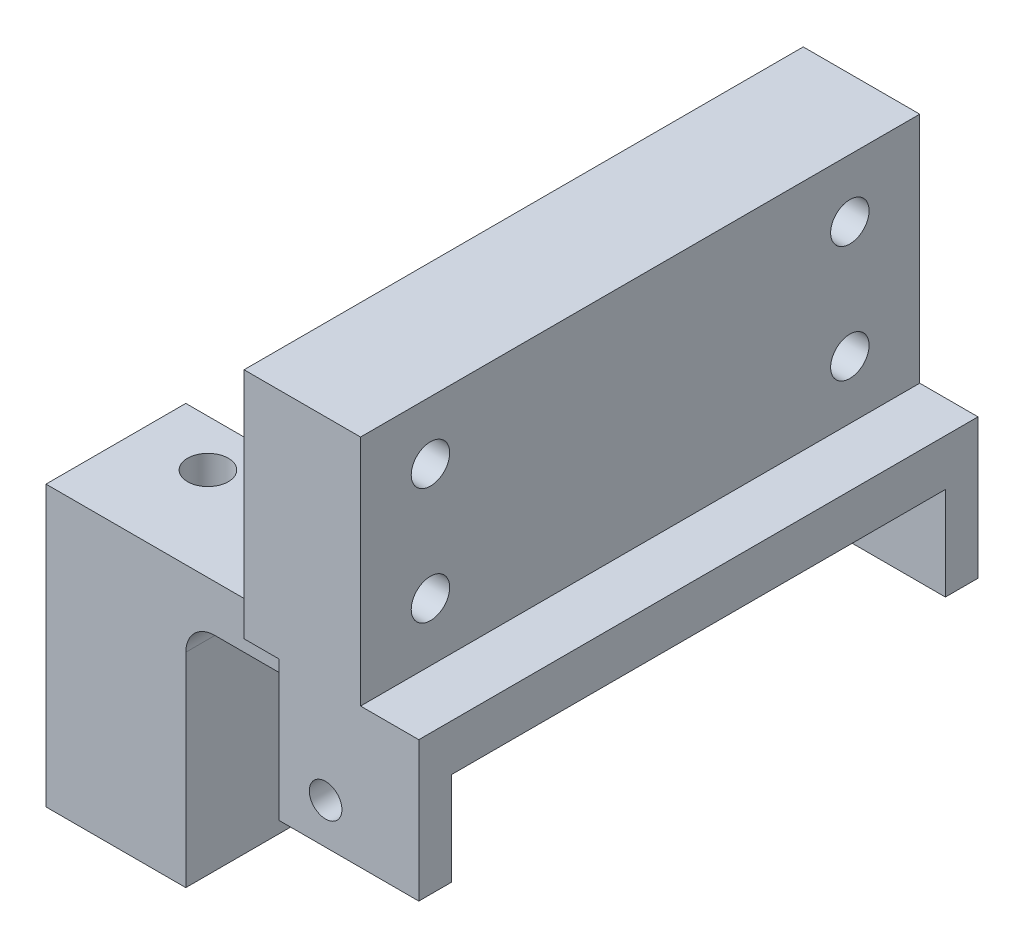
from build123d import *

# Parameters (mm, degrees)
SKETCH_1_W          = 20
SKETCH_1_H          = 48
EXTRUDE_2_DEPTH     = 4
SKETCH_3_W          = 20
SKETCH_3_H          = 3
EXTRUDE_3_DEPTH     = 8
SKETCH_4_W          = 12
SKETCH_4_H          = 4
EXTRUDE_4_DEPTH     = 15
SKETCH_5_R          = 1.75
CUT_EXTRUDE_2_DEPTH = 37.674241642
SKETCH_6_W          = 12
SKETCH_6_H          = 12
SKETCH_6_R          = 1.75
EXTRUDE_5_DEPTH     = 20
SKETCH_7_W          = 10
SKETCH_7_H          = 48
EXTRUDE_6_DEPTH     = 20
SKETCH_8_R          = 1.65
CUT_EXTRUDE_3_DEPTH = 46.299006612
CHAMFER_1_SIZE      = 3
FILLET_2_R          = 2.5
SKETCH_11_W         = 8
SKETCH_11_H         = 12
CUT_EXTRUDE_5_DEPTH = 3
SKETCH_12_R         = 1.4
CUT_EXTRUDE_6_DEPTH = 60.203040462
CHAMFER_2_SIZE      = 1.5
SKETCH_14_W         = 21.274376693
SKETCH_14_H         = 42.4
CUT_EXTRUDE_7_DEPTH = 8
SKETCH_15_W         = 103.642401021
SKETCH_15_H         = 66.860791826
CUT_EXTRUDE_8_DEPTH = 106


with BuildPart() as part:
    # 草图1 → 凸台-拉伸2 (new body)
    with BuildSketch(Plane(origin=(0, 0, 0), x_dir=(1, 0, 0), z_dir=(0, 1, 0))):
        Rectangle(SKETCH_1_W, SKETCH_1_H)
    extrude(amount=EXTRUDE_2_DEPTH)

    # 草图3 → 凸台-拉伸3 (add)
    with BuildSketch(Plane.XZ):
        with Locations((0, 22.5)):
            Rectangle(SKETCH_3_W, SKETCH_3_H)
        with Locations((0, -22.5)):
            Rectangle(SKETCH_3_W, SKETCH_3_H)
    extrude(amount=EXTRUDE_3_DEPTH)

    # 草图4 → 凸台-拉伸4 (add)
    with BuildSketch(Plane.ZY.offset(10)):
        with Locations((-15, 2)):
            Rectangle(SKETCH_4_W, SKETCH_4_H)
    extrude(amount=EXTRUDE_4_DEPTH)

    # 草图5 → 切除-拉伸2 (cut, through all)
    with BuildSketch(Plane(origin=(0, 4, 0), x_dir=(1, 0, 0), z_dir=(0, 1, 0))):
        with Locations(Location((-19.1, 13, 0), (0, 0, 270))):
            Circle(SKETCH_5_R)
    extrude(amount=-CUT_EXTRUDE_2_DEPTH, mode=Mode.SUBTRACT)

    # 草图6 → 凸台-拉伸5 (add)
    with BuildSketch(Plane.XZ):
        with Locations((-19, -15)):
            Rectangle(SKETCH_6_W, SKETCH_6_H)
        with Locations(Location((-19.1, -13, 0), (0, 0, 90))):
            Circle(SKETCH_6_R, mode=Mode.SUBTRACT)
    extrude(amount=EXTRUDE_5_DEPTH)

    # 草图7 → 凸台-拉伸6 (add)
    with BuildSketch(Plane(origin=(0, 4, 0), x_dir=(1, 0, 0), z_dir=(0, 1, 0))):
        Rectangle(SKETCH_7_W, SKETCH_7_H)
    extrude(amount=EXTRUDE_6_DEPTH)

    # 草图8 → 切除-拉伸3 (cut, through all)
    with BuildSketch(Plane(origin=(5, 0, 0), x_dir=(0, 0, -1), z_dir=(1, 0, 0))):
        with Locations((-18, 19)):
            Circle(SKETCH_8_R)
        with Locations((18, 19)):
            Circle(SKETCH_8_R)
        with Locations((18, 9)):
            Circle(SKETCH_8_R)
        with Locations((-18, 9)):
            Circle(SKETCH_8_R)
    extrude(amount=-CUT_EXTRUDE_3_DEPTH, mode=Mode.SUBTRACT)

    # 倒角1
    chamfer_1_edges = [part.edges().sort_by_distance(p)[0] for p in [
        (-10, -2, -24),
    ]]
    chamfer(chamfer_1_edges, length=CHAMFER_1_SIZE - 0.0001)  # a hair under: the kernel refuses the full size

    # 圆角2
    fillet_2_edges = [part.edges().sort_by_distance(p)[0] for p in [
        (-13, 0, -15),
    ]]
    fillet(fillet_2_edges, radius=FILLET_2_R)

    # 草图11 → 切除-拉伸5 (cut)
    with BuildSketch(Plane(origin=(0, 0, -24), x_dir=(-1, 0, 0), z_dir=(0, 0, -1))):
        with Locations((6, -2)):
            Rectangle(SKETCH_11_W, SKETCH_11_H)
    extrude(amount=-CUT_EXTRUDE_5_DEPTH, mode=Mode.SUBTRACT)

    # 草图12 → 切除-拉伸6 (cut, through all)
    with BuildSketch(Plane.XY.offset(24)):
        with Locations((2, -4.5)):
            Circle(SKETCH_12_R)
    extrude(amount=-CUT_EXTRUDE_6_DEPTH, mode=Mode.SUBTRACT)

    # 倒角2
    chamfer_2_edges = [part.edges().sort_by_distance(p)[0] for p in [
        (0.6, -4.5, 24),
    ]]
    chamfer(chamfer_2_edges, length=CHAMFER_2_SIZE)

    # 草图14 → 切除-拉伸7 (cut)
    with BuildSketch(Plane.XZ.offset(8)):
        with Locations((0.637188347, 0)):
            Rectangle(SKETCH_14_W, SKETCH_14_H)
    extrude(amount=-CUT_EXTRUDE_7_DEPTH, mode=Mode.SUBTRACT)


with BuildPart() as body_2:
    # 镜向2: mirrored copy
    add(part.part.mirror(Plane(origin=(0, 0, -34), x_dir=(1, 0, 0), z_dir=(0, 0, -1))))


with BuildPart() as part_1:
    add(part.part)

    # 草图15 → 切除-拉伸8 (cut, through all)
    with BuildSketch(Plane(origin=(0, 24, 0), x_dir=(1, 0, 0), z_dir=(0, 1, 0))):
        with Locations((-18.895114943, 2.939974457)):
            Rectangle(SKETCH_15_W, SKETCH_15_H)
    extrude(amount=-CUT_EXTRUDE_8_DEPTH, mode=Mode.SUBTRACT)


solid = body_2.part
